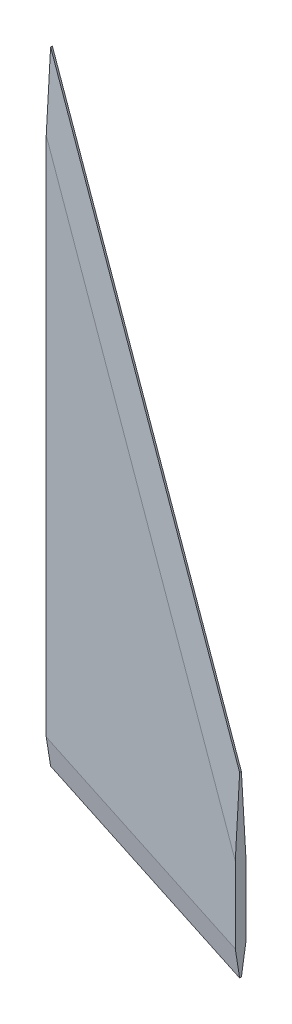
from build123d import *
from OCP.BRepFilletAPI import BRepFilletAPI_MakeChamfer

# Parameters (mm, degrees)
BOSS_EXTRUDE1_DEPTH = 1.5
CHAMFER1_SIZE       = 1.25
CHAMFER1_SIZE2      = 7.089102275


with BuildPart() as part:
    # Sketch1 → Boss-Extrude1 (new, symmetric)
    with BuildSketch(Plane.XY):
        Polygon((-16.410036231, -60.699177334), (-16.410036231, 117.100822666), (37.564963769, -35.299177334), (37.564963769, -86.099177334), align=None)
    extrude(amount=BOSS_EXTRUDE1_DEPTH, both=True)

    # Chamfer1: one chamfer whose edges measure the first distance from different faces: ONE call of the kernel's chamfer builder (chamfer() names one face for all edges)
    chamfer1_edges_1 = [part.edges().sort_by_distance(p)[0] for p in [
        (10.577463769, -73.399177334, -1.5),
        (10.577463769, -73.399177334, 1.5),
    ]]
    chamfer1_side_1 = [part.faces().sort_by_distance(p)[0] for p in [
        (10.577463769, -73.399177334, 0),
    ]]
    chamfer1_edges_2 = [part.edges().sort_by_distance(p)[0] for p in [
        (10.577463769, 40.900822666, -1.5),
        (10.577463769, 40.900822666, 1.5),
    ]]
    chamfer1_side_2 = [part.faces().sort_by_distance(p)[0] for p in [
        (10.577463769, 40.900822666, 0),
    ]]
    chamfer1 = BRepFilletAPI_MakeChamfer(part.part.solid().wrapped)
    for e in chamfer1_edges_1:
        chamfer1.Add(CHAMFER1_SIZE, CHAMFER1_SIZE2, e.wrapped, chamfer1_side_1[0].wrapped)  # the first distance lies on this face
    for e in chamfer1_edges_2:
        chamfer1.Add(CHAMFER1_SIZE, CHAMFER1_SIZE2, e.wrapped, chamfer1_side_2[0].wrapped)  # the first distance lies on this face
    add(Compound.cast(chamfer1.Shape()), mode=Mode.REPLACE)


solid = part.part
